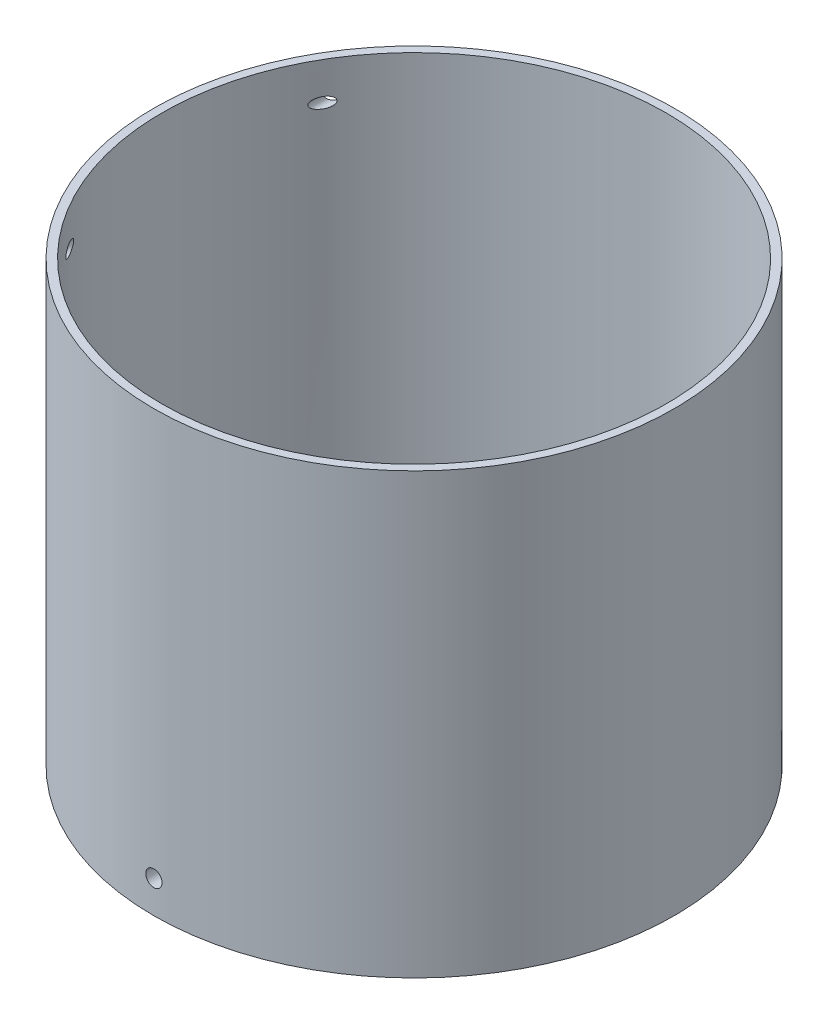
from build123d import *

# Parameters (mm, degrees)
SKETCH1_R               = 101.6
SKETCH1_R_2             = 95.25
BOSS_EXTRUDE1_DEPTH     = 25.4
CUT_EXTRUDE1_DEPTH      = 146.911891222
CUT_EXTRUDE1_DEPTH_BACK = 146.911891222
SKETCH2_R               = 3.175
SKETCH5_R               = 101.6
SKETCH5_R_2             = 98.425
BOSS_EXTRUDE2_DEPTH     = 146.05
SKETCH9_R               = 2.1
CUT_EXTRUDE5_DEPTH      = 285.618872521


with BuildPart() as part:
    # Sketch1 → Boss-Extrude1 (new body)
    with BuildSketch(Plane(origin=(0, 0, 0), x_dir=(1, 0, 0), z_dir=(0, 1, 0))):
        Circle(SKETCH1_R)
        Circle(SKETCH1_R_2, mode=Mode.SUBTRACT)
    extrude(amount=BOSS_EXTRUDE1_DEPTH)

    # Sketch2 → Cut-Extrude1 (cut, two sides: drawn at the far end of the back side and taken through both)
    with BuildSketch(Plane.XY.offset(-CUT_EXTRUDE1_DEPTH_BACK)):
        with Locations((0, 12.7)):
            Circle(SKETCH2_R)
    extrude(amount=CUT_EXTRUDE1_DEPTH + CUT_EXTRUDE1_DEPTH_BACK, mode=Mode.SUBTRACT)

    # Sketch5 → Boss-Extrude2 (add)
    with BuildSketch(Plane(origin=(0, 25.4, 0), x_dir=(1, 0, 0), z_dir=(0, 1, 0))):
        Circle(SKETCH5_R)
        Circle(SKETCH5_R_2, mode=Mode.SUBTRACT)
    extrude(amount=BOSS_EXTRUDE2_DEPTH)

    # Sketch9 → Cut-Extrude5 (cut, through all)
    with BuildSketch(Plane.XY.offset(101.6)):
        with Locations((-85.075, 156.8)):
            Circle(SKETCH9_R)
    extrude(amount=-CUT_EXTRUDE5_DEPTH, mode=Mode.SUBTRACT)


solid = part.part
